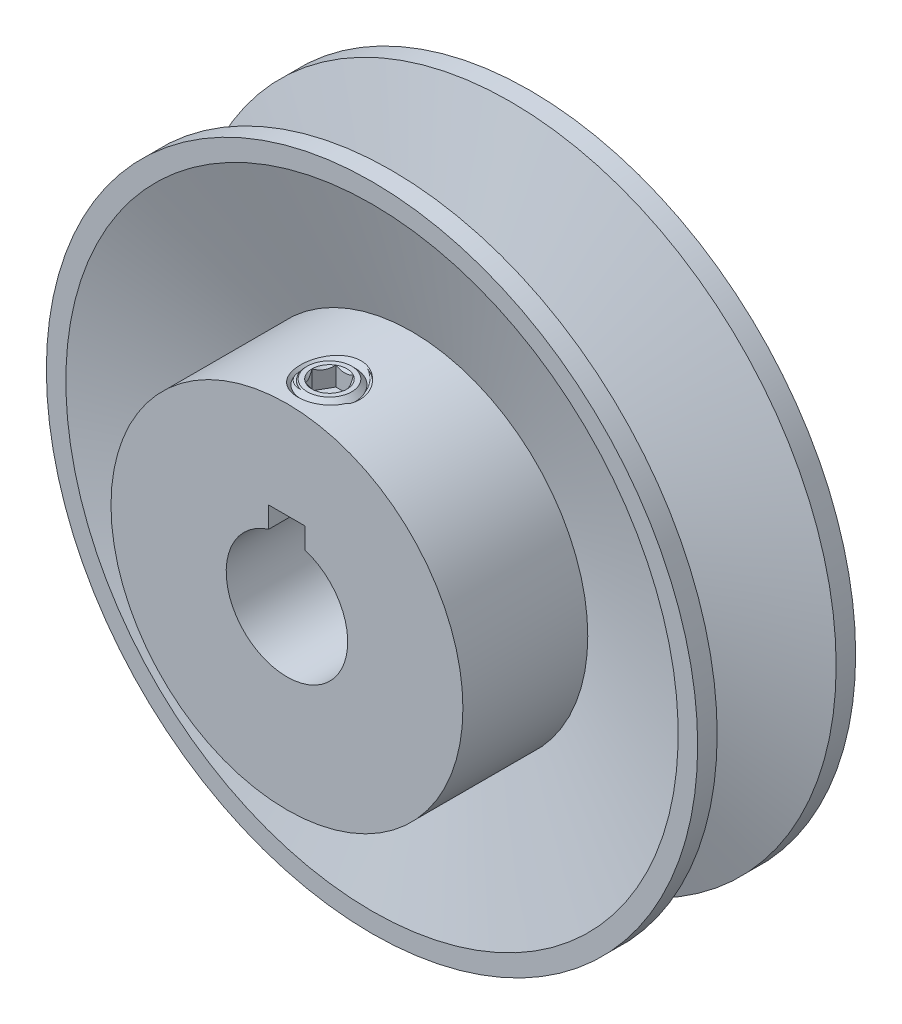
from build123d import *

# Parameters (mm, degrees)
SKETCH2_W          = 11.1125
SKETCH2_H          = 22.987
SKETCH3_R          = 7.9375
CUT_EXTRUDE1_DEPTH = 31.75
SKETCH4_W          = 4.7625
SKETCH4_H          = 4.7625
CUT_EXTRUDE2_DEPTH = 31.75
CUT_EXTRUDE3_REACH = 83.017
SKETCH5_R          = 3.086805556
CUT_SWEEP1_PITCH   = 1.411111111
CUT_SWEEP2_PITCH   = 1.411111111
CUT_EXTRUDE5_DEPTH = 2.48046875


with BuildPart() as part:
    # Sketch1 → Revolve1 (revolve)
    with BuildSketch(Plane(origin=(0, 0, 0), x_dir=(0, 0, -1), z_dir=(1, 0, 0)), mode=Mode.PRIVATE) as revolve1_sk:
        Polygon((7.7724, 42.545), (10.31875, 42.545), (10.31875, 39.99865), (3.176376826, 16.637), (6.35, 16.637), (6.35, 0), (-10.31875, 0), (-10.31875, 22.987), (-5.117766653, 22.987), (-10.31875, 39.99865), (-10.31875, 42.545), (-7.7724, 42.545), (-2.918925432, 26.67), (2.918925432, 26.67), align=None)
    revolve(revolve1_sk.sketch.rotate(Axis((0, 0, 21.43125), (0, 0, -1)), 180), axis=Axis((0, 0, 21.43125), (0, 0, -1)))

    # Sketch2 → Revolve2 (revolve)
    with BuildSketch(Plane(origin=(0, 0, 0), x_dir=(0, 0, -1), z_dir=(1, 0, 0)), mode=Mode.PRIVATE) as revolve2_sk:
        with Locations((-15.875, 11.4935)):
            Rectangle(SKETCH2_W, SKETCH2_H)
    revolve(revolve2_sk.sketch.rotate(Axis((0, 0, -10.31875), (0, 0, 1)), 180), axis=Axis((0, 0, -10.31875), (0, 0, 1)))

    # Sketch3 → Cut-Extrude1 (cut)
    with BuildSketch(Plane(origin=(0, 0, 21.43125), x_dir=(-1, 0, 0), z_dir=(0, 0, -1))):
        with Locations(Location((0, 0, 0), (0, 0, 270))):
            Circle(SKETCH3_R)
    extrude(amount=CUT_EXTRUDE1_DEPTH, mode=Mode.SUBTRACT)

    # Sketch4 → Cut-Extrude2 (cut)
    with BuildSketch(Plane(origin=(0, 0, 21.43125), x_dir=(-1, 0, 0), z_dir=(0, 0, -1))):
        with Locations((0, 7.9375)):
            Rectangle(SKETCH4_W, SKETCH4_H)
    extrude(amount=CUT_EXTRUDE2_DEPTH, mode=Mode.SUBTRACT)

    # Sketch5 → Cut-Extrude3 (cut, up to next)
    with BuildSketch(Plane(origin=(0, 22.987, 0), x_dir=(-1, 0, 0), z_dir=(0, 1, 0)), mode=Mode.PRIVATE) as cut_extrude3_sk1:
        with Locations(Location((0, 15.875, 0), (0, 0, 90))):
            Circle(SKETCH5_R)
    cut_extrude3_tool1 = extrude(cut_extrude3_sk1.sketch, amount=-CUT_EXTRUDE3_REACH, mode=Mode.PRIVATE) & part.part
    add(cut_extrude3_tool1.solids().sort_by_distance((0, 22.987, 15.875))[0], mode=Mode.SUBTRACT)

    # Cut-Sweep1: the profile of Sketch7 screwed along a right-hand helix of 17.29 turns, 8 arcs to a turn; built about Z, then put on its axis
    cut_sweep1_z = Axis((0, 0, 0), (0, 0, 1))
    cut_sweep1_corners = [(2.975827818, 0, -1.367013889), (2.975827818, 0, -0.044097222), (3.96875, 0, -0.617361111), (3.96875, 0, -0.79375)]
    with BuildLine(mode=Mode.PRIVATE) as cut_sweep1_profile:
        Line(cut_sweep1_corners[0], cut_sweep1_corners[1])
        Line(cut_sweep1_corners[1], cut_sweep1_corners[2])
        Line(cut_sweep1_corners[2], cut_sweep1_corners[3])
        Line(cut_sweep1_corners[3], cut_sweep1_corners[0])
    cut_sweep1_cap = Face(cut_sweep1_profile.wire())
    cut_sweep1_turn_angles = [0, 22.5, 45, 67.5, 90, 112.5, 135, 157.5, 180, 202.5, 225, 247.5, 270, 292.5, 315, 337.5, 360]
    cut_sweep1_turn_weights = [1, 0.9238795325112867, 1, 0.9238795325112867, 1, 0.9238795325112867, 1, 0.9238795325112867, 1, 0.9238795325112867, 1, 0.9238795325112867, 1, 0.9238795325112867, 1, 0.9238795325112867, 1]
    cut_sweep1_turn_rails = [Edge.make_bspline([Vector(p[0], p[1], 0).rotate(cut_sweep1_z, cut_sweep1_turn_angles[k]) / cut_sweep1_turn_weights[k] + Vector(0, 0, p[2] + CUT_SWEEP1_PITCH * cut_sweep1_turn_angles[k] / 360) for k in range(17)], [0, 0, 0, 1, 1, 2, 2, 3, 3, 4, 4, 5, 5, 6, 6, 7, 7, 8, 8, 8], 2, cut_sweep1_turn_weights) for p in cut_sweep1_corners]
    cut_sweep1_turn_sides = [Face.make_surface_from_curves(cut_sweep1_turn_rails[p[0]], cut_sweep1_turn_rails[p[1]]) for p in [(0, 1), (1, 2), (2, 3), (3, 0)]]
    cut_sweep1_last_angles = [6120, 6142.5, 6165, 6187.5, 6210, 6217.2, 6224.4]
    cut_sweep1_last_weights = [1, 0.9238795325112867, 1, 0.9238795325112867, 1, 0.9921147013144245, 1]
    cut_sweep1_last_rails = [Edge.make_bspline([Vector(p[0], p[1], 0).rotate(cut_sweep1_z, cut_sweep1_last_angles[k]) / cut_sweep1_last_weights[k] + Vector(0, 0, p[2] + CUT_SWEEP1_PITCH * cut_sweep1_last_angles[k] / 360) for k in range(7)], [0, 0, 0, 1, 1, 2, 2, 3, 3, 3], 2, cut_sweep1_last_weights) for p in cut_sweep1_corners]
    cut_sweep1_last_sides = [Face.make_surface_from_curves(cut_sweep1_last_rails[p[0]], cut_sweep1_last_rails[p[1]]) for p in [(0, 1), (1, 2), (2, 3), (3, 0)]]
    cut_sweep1 = Plane(origin=(0, 22.987, 15.875), x_dir=(0, 0, 1), z_dir=(0, -1, 0)) * Solid(Shell([*[p.moved(Location((0, 0, CUT_SWEEP1_PITCH * i))) for i in range(17) for p in cut_sweep1_turn_sides], *cut_sweep1_last_sides, cut_sweep1_cap, cut_sweep1_cap.rotate(cut_sweep1_z, 6224.4).moved(Location((0, 0, CUT_SWEEP1_PITCH * 6224.4 / 360)))]))
    add(cut_sweep1, mode=Mode.SUBTRACT)

    # Cut-Extrude4 cone 1 section (through the dimple's axis) → Cut-Extrude4 (revolve, cut)
    with BuildSketch(Plane(origin=(0, 22.987, 15.875), x_dir=(0, 0, 1), z_dir=(1, 0, 0))):
        Polygon((0, 0), (4.121507259, 0), (0, 4.121507259), align=None)
    revolve(axis=Axis((0, 22.987, 15.875), (0, -1, 0)), mode=Mode.SUBTRACT)


with BuildPart() as body_2:
    # Sketch9 → Revolve3 (revolve)
    with BuildSketch(Plane(origin=(0, 0, 0), x_dir=(0, 0, -1), z_dir=(1, 0, 0))):
        Polygon((-19.84375, 16.118800811), (-19.84375, 21.917699189), (-18.774449189, 22.987), (-15.875, 22.987), (-15.875, 15.0495), (-18.774449189, 15.0495), align=None)
    revolve(axis=Axis((0, 22.987, 15.875), (0, -1, 0)))

    # Cut-Sweep2: the profile of Sketch11 profile screwed along a right-hand helix of 6.625 turns, 8 arcs to a turn; built about Z, then put on its axis
    cut_sweep2_z = Axis((0, 0, 0), (0, 0, 1))
    cut_sweep2_corners = [(3.052206448, 0, -0.088194444), (3.052206448, 0, 0.088194444), (3.96905, 0, 0.617534316), (3.96905, 0, -0.617534316)]
    with BuildLine(mode=Mode.PRIVATE) as cut_sweep2_profile:
        Line(cut_sweep2_corners[0], cut_sweep2_corners[1])
        Line(cut_sweep2_corners[1], cut_sweep2_corners[2])
        Line(cut_sweep2_corners[2], cut_sweep2_corners[3])
        Line(cut_sweep2_corners[3], cut_sweep2_corners[0])
    cut_sweep2_cap = Face(cut_sweep2_profile.wire())
    cut_sweep2_turn_angles = [0, 22.5, 45, 67.5, 90, 112.5, 135, 157.5, 180, 202.5, 225, 247.5, 270, 292.5, 315, 337.5, 360]
    cut_sweep2_turn_weights = [1, 0.9238795325112867, 1, 0.9238795325112867, 1, 0.9238795325112867, 1, 0.9238795325112867, 1, 0.9238795325112867, 1, 0.9238795325112867, 1, 0.9238795325112867, 1, 0.9238795325112867, 1]
    cut_sweep2_turn_rails = [Edge.make_bspline([Vector(p[0], p[1], 0).rotate(cut_sweep2_z, cut_sweep2_turn_angles[k]) / cut_sweep2_turn_weights[k] + Vector(0, 0, p[2] + CUT_SWEEP2_PITCH * cut_sweep2_turn_angles[k] / 360) for k in range(17)], [0, 0, 0, 1, 1, 2, 2, 3, 3, 4, 4, 5, 5, 6, 6, 7, 7, 8, 8, 8], 2, cut_sweep2_turn_weights) for p in cut_sweep2_corners]
    cut_sweep2_turn_sides = [Face.make_surface_from_curves(cut_sweep2_turn_rails[p[0]], cut_sweep2_turn_rails[p[1]]) for p in [(0, 1), (1, 2), (2, 3), (3, 0)]]
    cut_sweep2_last_angles = [2160, 2182.5, 2205, 2227.5, 2250, 2272.5, 2295, 2317.5, 2340, 2362.5, 2385]
    cut_sweep2_last_weights = [1, 0.9238795325112867, 1, 0.9238795325112867, 1, 0.9238795325112867, 1, 0.9238795325112867, 1, 0.923879532511267, 1]
    cut_sweep2_last_rails = [Edge.make_bspline([Vector(p[0], p[1], 0).rotate(cut_sweep2_z, cut_sweep2_last_angles[k]) / cut_sweep2_last_weights[k] + Vector(0, 0, p[2] + CUT_SWEEP2_PITCH * cut_sweep2_last_angles[k] / 360) for k in range(11)], [0, 0, 0, 1, 1, 2, 2, 3, 3, 4, 4, 5, 5, 5], 2, cut_sweep2_last_weights) for p in cut_sweep2_corners]
    cut_sweep2_last_sides = [Face.make_surface_from_curves(cut_sweep2_last_rails[p[0]], cut_sweep2_last_rails[p[1]]) for p in [(0, 1), (1, 2), (2, 3), (3, 0)]]
    cut_sweep2 = Plane(origin=(0, 22.987, 15.875), x_dir=(0, 0, 1), z_dir=(0, -1, 0)) * Solid(Shell([*[p.moved(Location((0, 0, CUT_SWEEP2_PITCH * i))) for i in range(6) for p in cut_sweep2_turn_sides], *cut_sweep2_last_sides, cut_sweep2_cap, cut_sweep2_cap.rotate(cut_sweep2_z, 2385).moved(Location((0, 0, CUT_SWEEP2_PITCH * 2385 / 360)))]))
    add(cut_sweep2, mode=Mode.SUBTRACT)

    # Sketch12 → Cut-Extrude5 (cut)
    with BuildSketch(Plane(origin=(0, 22.987, 0), x_dir=(1, 0, 0), z_dir=(0, 1, 0))):
        Polygon((2.291358881, -15.875), (1.14567944, -13.890625), (-1.14567944, -13.890625), (-2.291358881, -15.875), (-1.14567944, -17.859375), (1.14567944, -17.859375), align=None)
    extrude(amount=-CUT_EXTRUDE5_DEPTH, mode=Mode.SUBTRACT)

    # Cut-Extrude6 cone 1 section (through the dimple's axis) → Cut-Extrude6 (revolve, cut)
    with BuildSketch(Plane(origin=(0, 22.987, 15.875), x_dir=(0, 0, 1), z_dir=(1, 0, 0))):
        Polygon((0, 0), (2.291358881, 0), (0, 2.291358881), align=None)
    revolve(axis=Axis((0, 22.987, 15.875), (0, -1, 0)), mode=Mode.SUBTRACT)


solid = Compound([part.part, body_2.part])
